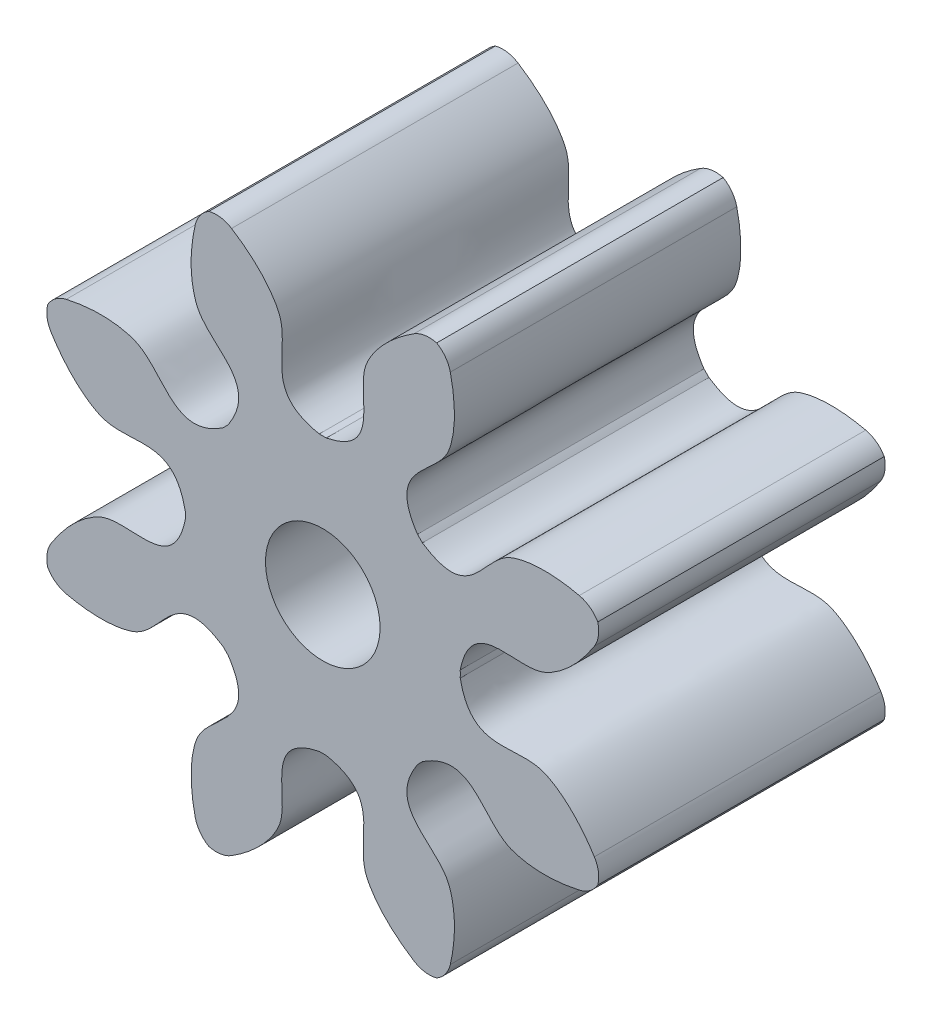
from build123d import *

# Parameters (mm, degrees)
SKETCH_1_R               = 5.2
EXTRUDE_1_DEPTH          = 5
CUT_EXTRUDE_1_DEPTH      = 9.89269363
PATTERN_CIRCULAR_1_COUNT = 8
FILLET_START             = -1
FILLET_1_DEPTH           = 7
PATTERN_CIRCULAR_2_COUNT = 8
SKETCH_4_R               = 1
CUT_EXTRUDE_2_DEPTH      = 9.450345548


with BuildPart() as part:
    # 草图1 → 凸台-拉伸1 (new body)
    with BuildSketch(Plane.XY):
        Circle(SKETCH_1_R)
    extrude(amount=EXTRUDE_1_DEPTH)

    # 草图2 → 切除-拉伸1 (cut, through all)
    with BuildSketch(Plane.XY):
        with BuildLine():
            ThreePointArc((0.060946848, 2.399226017), (0, 2.4), (-0.060946848, 2.399226017))
            add(Edge.make_bspline(
                [(-0.060946848, 2.399226017), (-1.056409697, 2.59937818), (-0.565235022, 3.352112188), (-0.758610153, 3.861532557), (-0.764103585, 3.875185279), (-0.770475944, 3.890150802), (-0.777780664, 3.906399122), (-0.786071665, 3.923898287), (-0.795401537, 3.942614813), (-0.805822041, 3.962513586), (-0.817383897, 3.983557921), (-0.830136799, 4.005709585), (-0.84412935, 4.028928819), (-0.859409032, 4.05317437), (-0.876022162, 4.078403519), (-0.894013852, 4.104572113), (-0.91342797, 4.131634592), (-0.934307106, 4.159544029), (-0.95669253, 4.188252153), (-0.980624157, 4.217709393), (-1.006140514, 4.247864906), (-1.033278701, 4.278666616), (-1.062074361, 4.310061252), (-1.092561647, 4.341994383), (-1.124773186, 4.374410458), (-1.158740052, 4.407252843), (-1.194491737, 4.440463866), (-1.232056116, 4.473984854), (-1.271459425, 4.507756176), (-1.312726232, 4.541717282), (-1.35587941, 4.575806753), (-1.400940114, 4.60996234), (-1.447927755, 4.644121006), (-1.496859977, 4.678218977), (-1.547752641, 4.712191783), (-1.600619797, 4.745974307), (-1.655473668, 4.77950083), (-1.712324631, 4.812705076), (-1.771181204, 4.845520267), (-1.832050023, 4.877879161), (-1.894935832, 4.909714109), (-1.959841469, 4.940957101), (-2.026767852, 4.971539813), (-2.09571397, 5.00139366), (-2.166676871, 5.030449844), (-2.239651655, 5.058639406), (-2.314631465, 5.085893275), (-2.391607483, 5.112142318), (-2.470568923, 5.137317394), (-2.551503028, 5.161349401), (-2.634395069, 5.184169333), (-2.71922834, 5.205708325), (-2.805984162, 5.225897708), (-2.894641884, 5.244669059), (-2.985178882, 5.261954255), (-3.077570569, 5.277685523), (-3.171790393, 5.291795488), (-3.26780985, 5.304217232), (-3.365598487, 5.314884337), (-3.465123914, 5.323730943), (-3.566351813, 5.330691794), (-3.66924595, 5.335702292), (-3.773768186, 5.338698546), (-3.879878494, 5.339617423), (-3.987534972, 5.338396597), (-4.096693862, 5.3349746), (-4.207309563, 5.329290871), (-4.319334656, 5.321285804), (-4.43271992, 5.310900797), (-4.547414357, 5.298078302), (-4.663365208, 5.282761871), (-4.780517986, 5.264896203), (-4.898816494, 5.244427191), (-5.018202854, 5.221301968), (-5.138617535, 5.195468953), (-5.259999379, 5.166877897), (-5.382285633, 5.135479925), (-5.505411978, 5.101227581), (-5.629312564, 5.06407487), (-5.753920039, 5.023977303), (-5.879165584, 4.980891935), (-6.004978953, 4.934777408), (-6.1312885, 4.885593991), (-6.258021224, 4.833303616), (-6.385102806, 4.777869922), (-6.512457644, 4.719258288), (-6.640008898, 4.657435869), (-6.767678522, 4.592371639), (-6.93886753, 4.500770756), (-7.065820376, 4.427833075), (-7.149902214, 4.37728691)],
                knots=[0, 0, 0, 0, 0.184779171, 0.186293458, 0.187985897, 0.189856487, 0.191905228, 0.19413212, 0.196537164, 0.19912036, 0.201881706, 0.204821205, 0.207938854, 0.211234655, 0.214708608, 0.218360711, 0.222190967, 0.226199373, 0.230385931, 0.234750641, 0.239293502, 0.244014514, 0.248913677, 0.253990992, 0.259246459, 0.264680077, 0.270291846, 0.276081767, 0.282049839, 0.288196062, 0.294520437, 0.301022963, 0.307703641, 0.31456247, 0.321599451, 0.328814583, 0.336207866, 0.343779301, 0.351528887, 0.359456624, 0.367562513, 0.375846553, 0.384308745, 0.392949088, 0.401767583, 0.410764229, 0.419939026, 0.429291975, 0.438823075, 0.448532327, 0.45841973, 0.468485284, 0.47872899, 0.489150847, 0.499750855, 0.510529015, 0.521485327, 0.53261979, 0.543932404, 0.555423169, 0.567092086, 0.578939155, 0.590964375, 0.603167746, 0.615549269, 0.628108943, 0.640846768, 0.653762745, 0.666856873, 0.680129153, 0.693579584, 0.707208166, 0.7210149, 0.734999785, 0.749162822, 0.76350401, 0.77802335, 0.792720841, 0.807596483, 0.822650277, 0.837882222, 0.853292318, 0.868880566, 0.884646965, 0.900591516, 0.916714218, 0.933015072, 0.949494077, 0.966151233, 1, 1, 1, 1], degree=3))
            ThreePointArc((-7.149902214, 4.37728691), (0, 8.383420684), (7.149902214, 4.37728691))
            add(Edge.make_bspline(
                [(0.060946848, 2.399226017), (1.056409697, 2.59937818), (0.565235022, 3.352112188), (0.758610153, 3.861532557), (0.764103585, 3.875185279), (0.770475944, 3.890150802), (0.777780664, 3.906399122), (0.786071665, 3.923898287), (0.795401537, 3.942614813), (0.805822041, 3.962513586), (0.817383897, 3.983557921), (0.830136799, 4.005709585), (0.84412935, 4.028928819), (0.859409032, 4.05317437), (0.876022162, 4.078403519), (0.894013852, 4.104572113), (0.91342797, 4.131634592), (0.934307106, 4.159544029), (0.95669253, 4.188252153), (0.980624157, 4.217709393), (1.006140514, 4.247864906), (1.033278701, 4.278666616), (1.062074361, 4.310061252), (1.092561647, 4.341994383), (1.124773186, 4.374410458), (1.158740052, 4.407252843), (1.194491737, 4.440463866), (1.232056116, 4.473984854), (1.271459425, 4.507756176), (1.312726232, 4.541717282), (1.35587941, 4.575806753), (1.400940114, 4.60996234), (1.447927755, 4.644121006), (1.496859977, 4.678218977), (1.547752641, 4.712191783), (1.600619797, 4.745974307), (1.655473668, 4.77950083), (1.712324631, 4.812705076), (1.771181204, 4.845520267), (1.832050023, 4.877879161), (1.894935832, 4.909714109), (1.959841469, 4.940957101), (2.026767852, 4.971539813), (2.09571397, 5.00139366), (2.166676871, 5.030449844), (2.239651655, 5.058639406), (2.314631465, 5.085893275), (2.391607483, 5.112142318), (2.470568923, 5.137317394), (2.551503028, 5.161349401), (2.634395069, 5.184169333), (2.71922834, 5.205708325), (2.805984162, 5.225897708), (2.894641884, 5.244669059), (2.985178882, 5.261954255), (3.077570569, 5.277685523), (3.171790393, 5.291795488), (3.26780985, 5.304217232), (3.365598487, 5.314884337), (3.465123914, 5.323730943), (3.566351813, 5.330691794), (3.66924595, 5.335702292), (3.773768186, 5.338698546), (3.879878494, 5.339617423), (3.987534972, 5.338396597), (4.096693862, 5.3349746), (4.207309563, 5.329290871), (4.319334656, 5.321285804), (4.43271992, 5.310900797), (4.547414357, 5.298078302), (4.663365208, 5.282761871), (4.780517986, 5.264896203), (4.898816494, 5.244427191), (5.018202854, 5.221301968), (5.138617535, 5.195468953), (5.259999379, 5.166877897), (5.382285633, 5.135479925), (5.505411978, 5.101227581), (5.629312564, 5.06407487), (5.753920039, 5.023977303), (5.879165584, 4.980891935), (6.004978953, 4.934777408), (6.1312885, 4.885593991), (6.258021224, 4.833303616), (6.385102806, 4.777869922), (6.512457644, 4.719258288), (6.640008898, 4.657435869), (6.767678522, 4.592371639), (6.93886753, 4.500770756), (7.065820376, 4.427833075), (7.149902214, 4.37728691)],
                knots=[0, 0, 0, 0, 0.184779171, 0.186293458, 0.187985897, 0.189856487, 0.191905228, 0.19413212, 0.196537164, 0.19912036, 0.201881706, 0.204821205, 0.207938854, 0.211234655, 0.214708608, 0.218360711, 0.222190967, 0.226199373, 0.230385931, 0.234750641, 0.239293502, 0.244014514, 0.248913677, 0.253990992, 0.259246459, 0.264680077, 0.270291846, 0.276081767, 0.282049839, 0.288196062, 0.294520437, 0.301022963, 0.307703641, 0.31456247, 0.321599451, 0.328814583, 0.336207866, 0.343779301, 0.351528887, 0.359456624, 0.367562513, 0.375846553, 0.384308745, 0.392949088, 0.401767583, 0.410764229, 0.419939026, 0.429291975, 0.438823075, 0.448532327, 0.45841973, 0.468485284, 0.47872899, 0.489150847, 0.499750855, 0.510529015, 0.521485327, 0.53261979, 0.543932404, 0.555423169, 0.567092086, 0.578939155, 0.590964375, 0.603167746, 0.615549269, 0.628108943, 0.640846768, 0.653762745, 0.666856873, 0.680129153, 0.693579584, 0.707208166, 0.7210149, 0.734999785, 0.749162822, 0.76350401, 0.77802335, 0.792720841, 0.807596483, 0.822650277, 0.837882222, 0.853292318, 0.868880566, 0.884646965, 0.900591516, 0.916714218, 0.933015072, 0.949494077, 0.966151233, 1, 1, 1, 1], degree=3))
        make_face()
    cut_extrude_1 = extrude(amount=CUT_EXTRUDE_1_DEPTH, mode=Mode.SUBTRACT)

    # 阵列(圆周)1: 切除-拉伸1 ×8 about axis
    pattern_circular_1_axis = Axis((0, 0, 5), (0, 0, -1))
    for i in range(1, PATTERN_CIRCULAR_1_COUNT):
        add(cut_extrude_1.rotate(pattern_circular_1_axis, i * 360 / PATTERN_CIRCULAR_1_COUNT), mode=Mode.SUBTRACT)

    # 圆角1: read off the stored shape, not the designer's step
    # 圆角1 outline → 圆角1 (cut)
    with BuildSketch(Plane.XY.offset(FILLET_START)):
        with BuildLine():
            add(Edge.make_bspline(
                [(1.591803293, 4.740194077), (1.594630766, 4.741974233), (1.615612817, 4.755137996), (1.655473668, 4.77950083), (1.712324631, 4.812705076), (1.767253127, 4.843330187), (1.803366558, 4.862620465), (1.819736096, 4.871197034)],
                knots=[0.327661793, 0.327661793, 0.327661793, 0.327661793, 0.328814583, 0.336207866, 0.343779301, 0.351528887, 0.357905006, 0.357905006, 0.357905006, 0.357905006], degree=3))
            ThreePointArc((1.591803293, 4.740194077), (1.783746558, 4.81149635), (1.988175798, 4.799880977))
            ThreePointArc((1.988175798, 4.799880977), (2.140942409, 4.663540984), (2.226248474, 4.477398279))
            add(Edge.make_bspline(
                [(2.157708722, 4.731204188), (2.163219183, 4.713564628), (2.175114948, 4.674388289), (2.192300037, 4.613892754), (2.209020791, 4.550214104), (2.219979544, 4.504801101), (2.225507908, 4.480656364), (2.226248474, 4.477398279)],
                knots=[0.642094994, 0.642094994, 0.642094994, 0.642094994, 0.648471113, 0.656220699, 0.663792134, 0.671185417, 0.672338207, 0.672338207, 0.672338207, 0.672338207], degree=3))
            ThreePointArc((2.157708722, 4.731204188), (1.989953848, 4.804173569), (1.819736096, 4.871197034))
        make_face()
    fillet_1 = extrude(amount=FILLET_1_DEPTH, mode=Mode.SUBTRACT)

    # 阵列(圆周)2: 圆角1 ×8 about axis
    pattern_circular_2_axis = Axis((0, 0, 0), (0, 0, 1))
    for i in range(1, PATTERN_CIRCULAR_2_COUNT):
        add(fillet_1.rotate(pattern_circular_2_axis, i * 360 / PATTERN_CIRCULAR_2_COUNT), mode=Mode.SUBTRACT)

    # 草图4 → 切除-拉伸2 (cut, through all)
    with BuildSketch(Plane(origin=(0, 0, 0), x_dir=(-1, 0, 0), z_dir=(0, 0, -1))):
        Circle(SKETCH_4_R)
    extrude(amount=-CUT_EXTRUDE_2_DEPTH, mode=Mode.SUBTRACT)


solid = part.part
